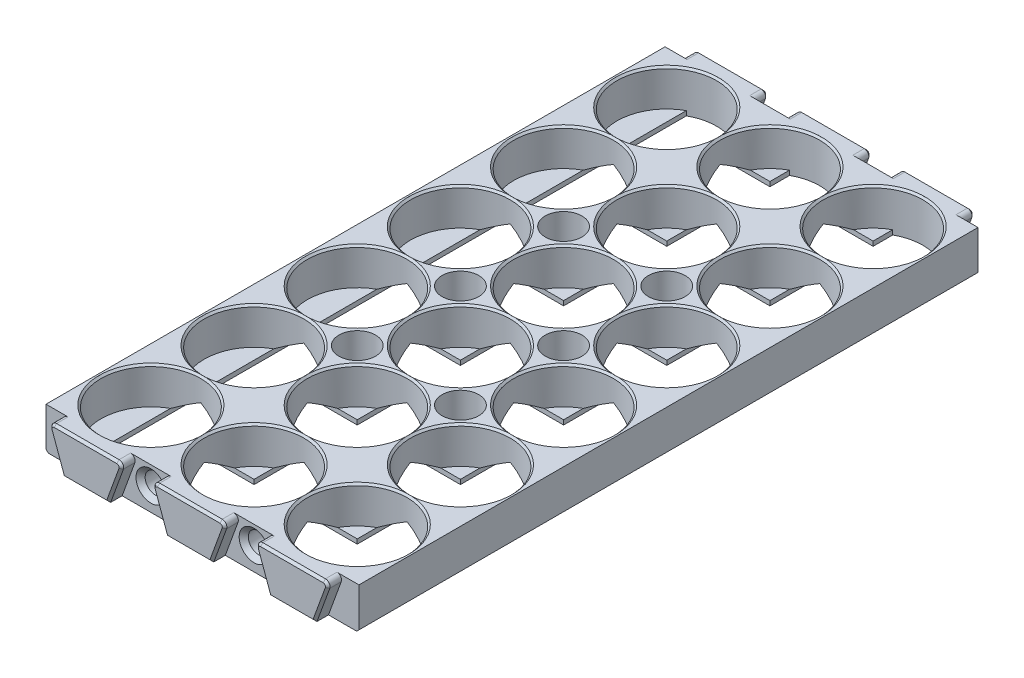
from build123d import *

# Parameters (mm, degrees)
SKETCH1_W                  = 22.5
SKETCH1_H                  = 22.5
SKETCH1_R                  = 10.875
BOSS_EXTRUDE1_DEPTH        = 8
SKETCH2_W                  = 6
SKETCH2_H                  = 6
BOSS_EXTRUDE2_DEPTH        = 1
CHAMFER2_SIZE              = 0.4
LPATTERN1_COUNT            = 6
LPATTERN1_PITCH            = 22.5
LPATTERN1_COUNT_DIR2       = 3
LPATTERN1_PITCH_DIR2       = 22.5
CHAMFER2_OF_LPATTERN1_SIZE = 0.4
SKETCH5_W                  = 6
SKETCH5_H                  = 1
BOSS_EXTRUDE3_DEPTH        = 123
BOSS_EXTRUDE4_START        = 1
BOSS_EXTRUDE4_DEPTH        = 1
CUT_EXTRUDE1_REACH         = 138.169
CUT_EXTRUDE7_REACH         = 138.169
BOSS_EXTRUDE5_DEPTH        = 3
BOSS_EXTRUDE6_DEPTH        = 3
FILLET1_R                  = 1
CHAMFER3_SIZE              = 0.5
SKETCH10_R                 = 2.25
CUT_EXTRUDE2_DEPTH         = 5
CUT_EXTRUDE3_START         = -5
SKETCH11_R                 = 2.25
CUT_EXTRUDE3_DEPTH         = 5
CHAMFER5_SIZE              = 1
SKETCH17_R                 = 4
CUT_EXTRUDE8_DEPTH         = 139.962674845
SKETCH18_R                 = 2.1
CUT_EXTRUDE9_DEPTH         = 4
SKETCH19_R                 = 1.7
CUT_EXTRUDE10_DEPTH        = 7
CHAMFER6_SIZE              = 1
SKETCH22_W                 = 0.375
SKETCH22_H                 = 135
BOSS_EXTRUDE7_DEPTH        = 9
CUT_EXTRUDE11_DEPTH        = 2
CHAMFER7_SIZE              = 0.5
CHAMFER9_SIZE              = 0.5


with BuildPart() as part:
    # Sketch1 → Boss-Extrude1 (new body)
    with BuildSketch(Plane(origin=(0, 0, 0), x_dir=(1, 0, 0), z_dir=(0, 1, 0))):
        Rectangle(SKETCH1_W, SKETCH1_H)
        with Locations(Location((0, 0, 0), (0, 0, 270))):
            Circle(SKETCH1_R, mode=Mode.SUBTRACT)
    boss_extrude1 = extrude(amount=BOSS_EXTRUDE1_DEPTH)

    # Sketch2 → Boss-Extrude2 (add)
    with BuildSketch(Plane.XZ):
        with Locations((8.25, 8.25)):
            Rectangle(SKETCH2_W, SKETCH2_H)
        with Locations((8.25, -8.25)):
            Rectangle(SKETCH2_W, SKETCH2_H)
        with Locations((-8.25, -8.25)):
            Rectangle(SKETCH2_W, SKETCH2_H)
        with Locations((-8.25, 8.25)):
            Rectangle(SKETCH2_W, SKETCH2_H)
    boss_extrude2 = extrude(amount=BOSS_EXTRUDE2_DEPTH)

    # Chamfer2
    # the kernel refuses this chamfer: 0.4 mm, written as the material it takes off along each edge
    with BuildSketch(Plane(origin=(0, 8, 0), x_dir=(0, 0, 1), z_dir=(-1, 0, 0))) as chamfer2_piece_1:
        Polygon((10.875, -CHAMFER2_SIZE), (10.875 + CHAMFER2_SIZE, 0), (10.875, 0), align=None)
    revolve(axis=Axis((0, 8, 0), (0, 1, 0)), mode=Mode.SUBTRACT)

    # LPattern1: Boss-Extrude1, Boss-Extrude2 6 × 3
    with Locations(*[(j * LPATTERN1_PITCH_DIR2, 0, i * LPATTERN1_PITCH) for i in range(LPATTERN1_COUNT) for j in range(LPATTERN1_COUNT_DIR2) if (i, j) != (0, 0)]):
        add(boss_extrude1)
        add(boss_extrude2)

    # Chamfer2 of LPattern1
    # the kernel refuses this chamfer: 0.4 mm, written as the material it takes off along each edge
    with BuildSketch(Plane(origin=(22.5, 8, 0), x_dir=(0, 0, 1), z_dir=(-1, 0, 0))) as chamfer2_of_lpattern1_piece_1:
        Polygon((10.875, -CHAMFER2_OF_LPATTERN1_SIZE), (10.875 + CHAMFER2_OF_LPATTERN1_SIZE, 0), (10.875, 0), align=None)
    revolve(axis=Axis((22.5, 8, 0), (0, 1, 0)), mode=Mode.SUBTRACT)
    with BuildSketch(Plane(origin=(45, 8, 0), x_dir=(0, 0, 1), z_dir=(-1, 0, 0))) as chamfer2_of_lpattern1_piece_2:
        Polygon((10.875 + CHAMFER2_OF_LPATTERN1_SIZE, 0), (10.875, -CHAMFER2_OF_LPATTERN1_SIZE), (10.875, 0), align=None)
    revolve(axis=Axis((45, 8, 0), (0, 1, 0)), mode=Mode.SUBTRACT)
    with BuildSketch(Plane(origin=(0, 8, 22.5), x_dir=(0, 0, 1), z_dir=(-1, 0, 0))) as chamfer2_of_lpattern1_piece_3:
        Polygon((10.875, -CHAMFER2_OF_LPATTERN1_SIZE), (10.875 + CHAMFER2_OF_LPATTERN1_SIZE, 0), (10.875, 0), align=None)
    revolve(axis=Axis((0, 8, 22.5), (0, 1, 0)), mode=Mode.SUBTRACT)
    with BuildSketch(Plane(origin=(22.5, 8, 22.5), x_dir=(0, 0, 1), z_dir=(-1, 0, 0))) as chamfer2_of_lpattern1_piece_4:
        Polygon((10.875, -CHAMFER2_OF_LPATTERN1_SIZE), (10.875 + CHAMFER2_OF_LPATTERN1_SIZE, 0), (10.875, 0), align=None)
    revolve(axis=Axis((22.5, 8, 22.5), (0, 1, 0)), mode=Mode.SUBTRACT)
    with BuildSketch(Plane(origin=(45, 8, 22.5), x_dir=(0, 0, 1), z_dir=(-1, 0, 0))) as chamfer2_of_lpattern1_piece_5:
        Polygon((10.875 + CHAMFER2_OF_LPATTERN1_SIZE, 0), (10.875, -CHAMFER2_OF_LPATTERN1_SIZE), (10.875, 0), align=None)
    revolve(axis=Axis((45, 8, 22.5), (0, 1, 0)), mode=Mode.SUBTRACT)
    with BuildSketch(Plane(origin=(0, 8, 45), x_dir=(0, 0, 1), z_dir=(-1, 0, 0))) as chamfer2_of_lpattern1_piece_6:
        Polygon((10.875, -CHAMFER2_OF_LPATTERN1_SIZE), (10.875 + CHAMFER2_OF_LPATTERN1_SIZE, 0), (10.875, 0), align=None)
    revolve(axis=Axis((0, 8, 45), (0, 1, 0)), mode=Mode.SUBTRACT)
    with BuildSketch(Plane(origin=(22.5, 8, 45), x_dir=(0, 0, 1), z_dir=(-1, 0, 0))) as chamfer2_of_lpattern1_piece_7:
        Polygon((10.875, -CHAMFER2_OF_LPATTERN1_SIZE), (10.875 + CHAMFER2_OF_LPATTERN1_SIZE, 0), (10.875, 0), align=None)
    revolve(axis=Axis((22.5, 8, 45), (0, 1, 0)), mode=Mode.SUBTRACT)
    with BuildSketch(Plane(origin=(45, 8, 45), x_dir=(0, 0, 1), z_dir=(-1, 0, 0))) as chamfer2_of_lpattern1_piece_8:
        Polygon((10.875, -CHAMFER2_OF_LPATTERN1_SIZE), (10.875 + CHAMFER2_OF_LPATTERN1_SIZE, 0), (10.875, 0), align=None)
    revolve(axis=Axis((45, 8, 45), (0, 1, 0)), mode=Mode.SUBTRACT)
    with BuildSketch(Plane(origin=(0, 8, 67.5), x_dir=(0, 0, 1), z_dir=(-1, 0, 0))) as chamfer2_of_lpattern1_piece_9:
        Polygon((10.875, -CHAMFER2_OF_LPATTERN1_SIZE), (10.875 + CHAMFER2_OF_LPATTERN1_SIZE, 0), (10.875, 0), align=None)
    revolve(axis=Axis((0, 8, 67.5), (0, 1, 0)), mode=Mode.SUBTRACT)
    with BuildSketch(Plane(origin=(22.5, 8, 67.5), x_dir=(0, 0, 1), z_dir=(-1, 0, 0))) as chamfer2_of_lpattern1_piece_10:
        Polygon((10.875, -CHAMFER2_OF_LPATTERN1_SIZE), (10.875 + CHAMFER2_OF_LPATTERN1_SIZE, 0), (10.875, 0), align=None)
    revolve(axis=Axis((22.5, 8, 67.5), (0, 1, 0)), mode=Mode.SUBTRACT)
    with BuildSketch(Plane(origin=(45, 8, 67.5), x_dir=(0, 0, 1), z_dir=(-1, 0, 0))) as chamfer2_of_lpattern1_piece_11:
        Polygon((10.875, -CHAMFER2_OF_LPATTERN1_SIZE), (10.875 + CHAMFER2_OF_LPATTERN1_SIZE, 0), (10.875, 0), align=None)
    revolve(axis=Axis((45, 8, 67.5), (0, 1, 0)), mode=Mode.SUBTRACT)
    with BuildSketch(Plane(origin=(0, 8, 90), x_dir=(0, 0, 1), z_dir=(-1, 0, 0))) as chamfer2_of_lpattern1_piece_12:
        Polygon((10.875, -CHAMFER2_OF_LPATTERN1_SIZE), (10.875 + CHAMFER2_OF_LPATTERN1_SIZE, 0), (10.875, 0), align=None)
    revolve(axis=Axis((0, 8, 90), (0, 1, 0)), mode=Mode.SUBTRACT)
    with BuildSketch(Plane(origin=(22.5, 8, 90), x_dir=(0, 0, 1), z_dir=(-1, 0, 0))) as chamfer2_of_lpattern1_piece_13:
        Polygon((10.875, -CHAMFER2_OF_LPATTERN1_SIZE), (10.875 + CHAMFER2_OF_LPATTERN1_SIZE, 0), (10.875, 0), align=None)
    revolve(axis=Axis((22.5, 8, 90), (0, 1, 0)), mode=Mode.SUBTRACT)
    with BuildSketch(Plane(origin=(45, 8, 90), x_dir=(0, 0, 1), z_dir=(-1, 0, 0))) as chamfer2_of_lpattern1_piece_14:
        Polygon((10.875, -CHAMFER2_OF_LPATTERN1_SIZE), (10.875 + CHAMFER2_OF_LPATTERN1_SIZE, 0), (10.875, 0), align=None)
    revolve(axis=Axis((45, 8, 90), (0, 1, 0)), mode=Mode.SUBTRACT)
    with BuildSketch(Plane(origin=(0, 8, 112.5), x_dir=(0, 0, 1), z_dir=(-1, 0, 0))) as chamfer2_of_lpattern1_piece_15:
        Polygon((10.875, -CHAMFER2_OF_LPATTERN1_SIZE), (10.875 + CHAMFER2_OF_LPATTERN1_SIZE, 0), (10.875, 0), align=None)
    revolve(axis=Axis((0, 8, 112.5), (0, 1, 0)), mode=Mode.SUBTRACT)
    with BuildSketch(Plane(origin=(22.5, 8, 112.5), x_dir=(0, 0, 1), z_dir=(-1, 0, 0))) as chamfer2_of_lpattern1_piece_16:
        Polygon((10.875, -CHAMFER2_OF_LPATTERN1_SIZE), (10.875 + CHAMFER2_OF_LPATTERN1_SIZE, 0), (10.875, 0), align=None)
    revolve(axis=Axis((22.5, 8, 112.5), (0, 1, 0)), mode=Mode.SUBTRACT)
    with BuildSketch(Plane(origin=(45, 8, 112.5), x_dir=(0, 0, 1), z_dir=(-1, 0, 0))) as chamfer2_of_lpattern1_piece_17:
        Polygon((10.875, -CHAMFER2_OF_LPATTERN1_SIZE), (10.875 + CHAMFER2_OF_LPATTERN1_SIZE, 0), (10.875, 0), align=None)
    revolve(axis=Axis((45, 8, 112.5), (0, 1, 0)), mode=Mode.SUBTRACT)

    # Sketch5 → Boss-Extrude3 (add)
    with BuildSketch(Plane.XY.offset(-5.25)):
        with Locations((-8.25, -0.5)):
            Rectangle(SKETCH5_W, SKETCH5_H)
        with Locations((53.25, -0.5)):
            Rectangle(SKETCH5_W, SKETCH5_H)
    extrude(amount=BOSS_EXTRUDE3_DEPTH)

    # Sketch6 → Boss-Extrude4 (add)
    with BuildSketch(Plane.XZ.offset(BOSS_EXTRUDE4_START)):
        with BuildLine():
            Line((39.75, -11.25), (50.25, -11.25))
            Line((50.25, -11.25), (50.25, -9.523818824))
            ThreePointArc((50.25, -9.523818824), (45, -10.875), (39.75, -9.523818824))
            Line((39.75, -9.523818824), (39.75, -11.25))
        make_face()
        with BuildLine():
            Line((17.25, -9.523818824), (17.25, -11.25))
            Line((17.25, -11.25), (27.75, -11.25))
            Line((27.75, -11.25), (27.75, -9.523818824))
            ThreePointArc((27.75, -9.523818824), (22.5, -10.875), (17.25, -9.523818824))
        make_face()
        with BuildLine():
            Line((-5.25, -9.523818824), (-5.25, -11.25))
            Line((-5.25, -11.25), (5.25, -11.25))
            Line((5.25, -11.25), (5.25, -9.523818824))
            ThreePointArc((5.25, -9.523818824), (0, -10.875), (-5.25, -9.523818824))
        make_face()
        with BuildLine():
            Line((50.25, 122.023818824), (50.25, 123.75))
            Line((50.25, 123.75), (39.75, 123.75))
            Line((39.75, 123.75), (39.75, 122.023818824))
            ThreePointArc((39.75, 122.023818824), (45, 123.375), (50.25, 122.023818824))
        make_face()
        with BuildLine():
            Line((27.75, 122.023818824), (27.75, 123.75))
            Line((27.75, 123.75), (17.25, 123.75))
            Line((17.25, 123.75), (17.25, 122.023818824))
            ThreePointArc((17.25, 122.023818824), (22.5, 123.375), (27.75, 122.023818824))
        make_face()
        with BuildLine():
            Line((5.25, 123.75), (-5.25, 123.75))
            Line((-5.25, 123.75), (-5.25, 122.023818824))
            ThreePointArc((-5.25, 122.023818824), (0, 123.375), (5.25, 122.023818824))
            Line((5.25, 122.023818824), (5.25, 123.75))
        make_face()
    extrude(amount=-BOSS_EXTRUDE4_DEPTH)

    # Cut-Extrude1: up to this face of the body (flat: up to its plane)
    cut_extrude1_end = Plane(part.part.faces().sort_by_distance((11.25, -0.5, 117.75))[0])
    # Sketch7 → Cut-Extrude1 (cut, up to the picked face)
    with BuildSketch(Plane.XY, mode=Mode.PRIVATE) as cut_extrude1_sk1:
        Polygon((-5.25, 0), (5.25, 0), (0, 3.031088913), align=None)
    cut_extrude1_tool1 = split(extrude(cut_extrude1_sk1.sketch, amount=CUT_EXTRUDE1_REACH, mode=Mode.PRIVATE), bisect_by=cut_extrude1_end, keep=Keep.BOTH, mode=Mode.PRIVATE)
    # Sketch7 → Cut-Extrude1 (cut, up to the picked face)
    with BuildSketch(Plane.XY, mode=Mode.PRIVATE) as cut_extrude1_sk2:
        Polygon((17.25, 0), (22.5, 3.031088913), (27.75, 0), align=None)
    cut_extrude1_tool2 = split(extrude(cut_extrude1_sk2.sketch, amount=CUT_EXTRUDE1_REACH, mode=Mode.PRIVATE), bisect_by=cut_extrude1_end, keep=Keep.BOTH, mode=Mode.PRIVATE)
    # Sketch7 → Cut-Extrude1 (cut, up to the picked face)
    with BuildSketch(Plane.XY, mode=Mode.PRIVATE) as cut_extrude1_sk3:
        Polygon((39.75, 0), (45, 3.031088913), (50.25, 0), align=None)
    cut_extrude1_tool3 = split(extrude(cut_extrude1_sk3.sketch, amount=CUT_EXTRUDE1_REACH, mode=Mode.PRIVATE), bisect_by=cut_extrude1_end, keep=Keep.BOTH, mode=Mode.PRIVATE)
    add(cut_extrude1_tool1.solids().sort_by(Axis((0, 1.010363, 0), (0, 0, 1)))[0], mode=Mode.SUBTRACT)
    add(cut_extrude1_tool2.solids().sort_by(Axis((22.5, 1.010363, 0), (0, 0, 1)))[0], mode=Mode.SUBTRACT)
    add(cut_extrude1_tool3.solids().sort_by(Axis((45, 1.010363, 0), (0, 0, 1)))[0], mode=Mode.SUBTRACT)

    # Cut-Extrude7: up to this face of the body (flat: up to its plane)
    cut_extrude7_end = Plane(part.part.faces().sort_by_distance((39.75, -0.5, 11.25))[0])
    # Sketch16 → Cut-Extrude7 (cut, up to the picked face)
    with BuildSketch(Plane(origin=(0, 0, 0), x_dir=(0, 0, -1), z_dir=(1, 0, 0)), mode=Mode.PRIVATE) as cut_extrude7_sk1:
        Polygon((-5.25, 0), (0, 3.031088913), (5.25, 0), align=None)
    cut_extrude7_tool1 = split(extrude(cut_extrude7_sk1.sketch, amount=CUT_EXTRUDE7_REACH, mode=Mode.PRIVATE), bisect_by=cut_extrude7_end, keep=Keep.BOTH, mode=Mode.PRIVATE)
    # Sketch16 → Cut-Extrude7 (cut, up to the picked face)
    with BuildSketch(Plane(origin=(0, 0, 0), x_dir=(0, 0, -1), z_dir=(1, 0, 0)), mode=Mode.PRIVATE) as cut_extrude7_sk2:
        Polygon((-22.5, 3.031088913), (-17.25, 0), (-27.75, 0), align=None)
    cut_extrude7_tool2 = split(extrude(cut_extrude7_sk2.sketch, amount=CUT_EXTRUDE7_REACH, mode=Mode.PRIVATE), bisect_by=cut_extrude7_end, keep=Keep.BOTH, mode=Mode.PRIVATE)
    # Sketch16 → Cut-Extrude7 (cut, up to the picked face)
    with BuildSketch(Plane(origin=(0, 0, 0), x_dir=(0, 0, -1), z_dir=(1, 0, 0)), mode=Mode.PRIVATE) as cut_extrude7_sk3:
        Polygon((-45, 3.031088913), (-39.75, 0), (-50.25, 0), align=None)
    cut_extrude7_tool3 = split(extrude(cut_extrude7_sk3.sketch, amount=CUT_EXTRUDE7_REACH, mode=Mode.PRIVATE), bisect_by=cut_extrude7_end, keep=Keep.BOTH, mode=Mode.PRIVATE)
    # Sketch16 → Cut-Extrude7 (cut, up to the picked face)
    with BuildSketch(Plane(origin=(0, 0, 0), x_dir=(0, 0, -1), z_dir=(1, 0, 0)), mode=Mode.PRIVATE) as cut_extrude7_sk4:
        Polygon((-67.5, 3.031088913), (-62.25, 0), (-72.75, 0), align=None)
    cut_extrude7_tool4 = split(extrude(cut_extrude7_sk4.sketch, amount=CUT_EXTRUDE7_REACH, mode=Mode.PRIVATE), bisect_by=cut_extrude7_end, keep=Keep.BOTH, mode=Mode.PRIVATE)
    # Sketch16 → Cut-Extrude7 (cut, up to the picked face)
    with BuildSketch(Plane(origin=(0, 0, 0), x_dir=(0, 0, -1), z_dir=(1, 0, 0)), mode=Mode.PRIVATE) as cut_extrude7_sk5:
        Polygon((-90, 3.031088913), (-84.75, 0), (-95.25, 0), align=None)
    cut_extrude7_tool5 = split(extrude(cut_extrude7_sk5.sketch, amount=CUT_EXTRUDE7_REACH, mode=Mode.PRIVATE), bisect_by=cut_extrude7_end, keep=Keep.BOTH, mode=Mode.PRIVATE)
    # Sketch16 → Cut-Extrude7 (cut, up to the picked face)
    with BuildSketch(Plane(origin=(0, 0, 0), x_dir=(0, 0, -1), z_dir=(1, 0, 0)), mode=Mode.PRIVATE) as cut_extrude7_sk6:
        Polygon((-112.5, 3.031088913), (-107.25, 0), (-117.75, 0), align=None)
    cut_extrude7_tool6 = split(extrude(cut_extrude7_sk6.sketch, amount=CUT_EXTRUDE7_REACH, mode=Mode.PRIVATE), bisect_by=cut_extrude7_end, keep=Keep.BOTH, mode=Mode.PRIVATE)
    add(cut_extrude7_tool1.solids().sort_by(Axis((0, 1.010363, 0), (1, 0, 0)))[0], mode=Mode.SUBTRACT)
    add(cut_extrude7_tool2.solids().sort_by(Axis((0, 1.010363, 22.5), (1, 0, 0)))[0], mode=Mode.SUBTRACT)
    add(cut_extrude7_tool3.solids().sort_by(Axis((0, 1.010363, 45), (1, 0, 0)))[0], mode=Mode.SUBTRACT)
    add(cut_extrude7_tool4.solids().sort_by(Axis((0, 1.010363, 67.5), (1, 0, 0)))[0], mode=Mode.SUBTRACT)
    add(cut_extrude7_tool5.solids().sort_by(Axis((0, 1.010363, 90), (1, 0, 0)))[0], mode=Mode.SUBTRACT)
    add(cut_extrude7_tool6.solids().sort_by(Axis((0, 1.010363, 112.5), (1, 0, 0)))[0], mode=Mode.SUBTRACT)

    # Sketch8 → Boss-Extrude5 (add)
    with BuildSketch(Plane(origin=(0, 0, -11.25), x_dir=(-1, 0, 0), z_dir=(0, 0, -1))):
        Polygon((-27.474267892, -1), (-30.75, 8), (-14.25, 8), (-17.525732108, -1), align=None)
        Polygon((4.974267892, -1), (-4.974267892, -1), (-8.25, 8), (8.25, 8), align=None)
        Polygon((-49.974267892, -1), (-53.25, 8), (-36.75, 8), (-40.025732108, -1), align=None)
    extrude(amount=BOSS_EXTRUDE5_DEPTH)

    # Sketch9 → Boss-Extrude6 (add)
    with BuildSketch(Plane.XY.offset(123.75)):
        Polygon((-4.974267892, -1), (4.974267892, -1), (8.25, 8), (-8.25, 8), align=None)
        Polygon((49.974267892, -1), (53.25, 8), (36.75, 8), (40.025732108, -1), align=None)
        Polygon((14.25, 8), (17.525732108, -1), (27.474267892, -1), (30.75, 8), align=None)
    extrude(amount=BOSS_EXTRUDE6_DEPTH)

    # Fillet1
    fillet1_edges = [part.edges().sort_by_distance(p)[0] for p in [
        (-8.25, 8, -12.75),
        (8.25, 8, -12.75),
        (14.25, 8, -12.75),
        (30.75, 8, -12.75),
        (36.75, 8, -12.75),
        (53.25, 8, -12.75),
        (-8.25, 8, 125.25),
        (8.25, 8, 125.25),
        (53.25, 8, 125.25),
        (36.75, 8, 125.25),
        (30.75, 8, 125.25),
        (14.25, 8, 125.25),
    ]]
    fillet(fillet1_edges, radius=FILLET1_R)

    # Chamfer3
    chamfer3_edges = [part.edges().sort_by_distance(p)[0] for p in [
        (0, -1, -14.25),
        (-6.367906253, 2.828989928, -14.25),
        (22.5, -1, -14.25),
        (16.132093747, 2.828989928, -14.25),
        (45, -1, -14.25),
        (38.632093747, 2.828989928, -14.25),
        (0, -1, 126.75),
        (6.367906253, 2.828989928, 126.75),
        (45, -1, 126.75),
        (51.367906253, 2.828989928, 126.75),
        (22.5, -1, 126.75),
        (28.867906253, 2.828989928, 126.75),
        (0, 8, 126.75),
        (22.5, 8, 126.75),
        (45, 8, 126.75),
        (-6.367906253, 2.828989928, 126.75),
        (-7.641004038, 7.573576436, 126.75),
        (7.641004038, 7.573576436, 126.75),
        (16.132093747, 2.828989928, 126.75),
        (30.141004038, 7.573576436, 126.75),
        (14.858995962, 7.573576436, 126.75),
        (38.632093747, 2.828989928, 126.75),
        (52.641004038, 7.573576436, 126.75),
        (37.358995962, 7.573576436, 126.75),
        (51.367906253, 2.828989928, -14.25),
        (45, 8, -14.25),
        (22.5, 8, -14.25),
        (0, 8, -14.25),
        (37.358995962, 7.573576436, -14.25),
        (52.641004038, 7.573576436, -14.25),
        (28.867906253, 2.828989928, -14.25),
        (14.858995962, 7.573576436, -14.25),
        (30.141004038, 7.573576436, -14.25),
        (6.367906253, 2.828989928, -14.25),
        (-7.641004038, 7.573576436, -14.25),
        (7.641004038, 7.573576436, -14.25),
    ]]
    chamfer(chamfer3_edges, length=CHAMFER3_SIZE)

    # Sketch10 → Cut-Extrude2 (cut)
    with BuildSketch(Plane(origin=(0, 0, -11.25), x_dir=(-1, 0, 0), z_dir=(0, 0, -1))):
        with Locations((-11.25, 4)):
            Circle(SKETCH10_R)
        with Locations(Location((-33.75, 4, 0), (0, 0, 180))):
            Circle(SKETCH10_R)
    extrude(amount=-CUT_EXTRUDE2_DEPTH, mode=Mode.SUBTRACT)

    # Sketch11 → Cut-Extrude3 (cut)
    with BuildSketch(Plane.XY.offset(123.75).offset(CUT_EXTRUDE3_START)):
        with Locations(Location((11.25, 4, 0), (0, 0, 180))):
            Circle(SKETCH11_R)
        with Locations((33.75, 4)):
            Circle(SKETCH11_R)
    extrude(amount=CUT_EXTRUDE3_DEPTH, mode=Mode.SUBTRACT)

    # Chamfer5
    chamfer5_edges = [part.edges().sort_by_distance(p)[0] for p in [
        (31.5, 4, -11.25),
        (13.5, 4, -11.25),
        (13.5, 4, 123.75),
        (31.5, 4, 123.75),
    ]]
    chamfer(chamfer5_edges, length=CHAMFER5_SIZE)

    # Sketch17 → Cut-Extrude8 (cut, through all)
    with BuildSketch(Plane.XZ.offset(1)):
        with Locations(Location((33.75, 33.75, 0), (0, 0, 270))):
            Circle(SKETCH17_R)
        with Locations(Location((33.75, 56.25, 0), (0, 0, 270))):
            Circle(SKETCH17_R)
        with Locations(Location((33.75, 78.75, 0), (0, 0, 270))):
            Circle(SKETCH17_R)
        with Locations(Location((11.25, 33.75, 0), (0, 0, 270))):
            Circle(SKETCH17_R)
        with Locations(Location((11.25, 56.25, 0), (0, 0, 270))):
            Circle(SKETCH17_R)
        with Locations(Location((11.25, 78.75, 0), (0, 0, 270))):
            Circle(SKETCH17_R)
    extrude(amount=-CUT_EXTRUDE8_DEPTH, mode=Mode.SUBTRACT)

    # Sketch18 → Cut-Extrude9 (cut)
    with BuildSketch(Plane.XZ.offset(1)):
        with Locations(Location((11.25, 11.25, 0), (0, 0, 270))):
            Circle(SKETCH18_R)
        with Locations(Location((33.75, 11.25, 0), (0, 0, 270))):
            Circle(SKETCH18_R)
        with Locations(Location((33.75, 101.25, 0), (0, 0, 90))):
            Circle(SKETCH18_R)
        with Locations(Location((11.25, 101.25, 0), (0, 0, 90))):
            Circle(SKETCH18_R)
    extrude(amount=-CUT_EXTRUDE9_DEPTH, mode=Mode.SUBTRACT)

    # Sketch19 → Cut-Extrude10 (cut)
    with BuildSketch(Plane.XZ.offset(1)):
        with Locations(Location((33.75, 11.25, 0), (0, 0, 270))):
            Circle(SKETCH19_R)
        with Locations(Location((11.25, 11.25, 0), (0, 0, 270))):
            Circle(SKETCH19_R)
        with Locations(Location((11.25, 101.25, 0), (0, 0, 270))):
            Circle(SKETCH19_R)
        with Locations(Location((33.75, 101.25, 0), (0, 0, 270))):
            Circle(SKETCH19_R)
    extrude(amount=-CUT_EXTRUDE10_DEPTH, mode=Mode.SUBTRACT)

    # Chamfer6
    chamfer6_edges = [part.edges().sort_by_distance(p)[0] for p in [
        (11.25, -1, 99.15),
        (33.75, -1, 99.15),
        (33.75, -1, 13.35),
        (11.25, -1, 13.35),
    ]]
    chamfer(chamfer6_edges, length=CHAMFER6_SIZE)

    # Sketch22 → Boss-Extrude7 (add)
    with BuildSketch(Plane(origin=(0, 8, 0), x_dir=(1, 0, 0), z_dir=(0, 1, 0))):
        with Locations((-11.4375, -56.25)):
            Rectangle(SKETCH22_W, SKETCH22_H)
        with Locations((56.4375, -56.25)):
            Rectangle(SKETCH22_W, SKETCH22_H)
    extrude(amount=-BOSS_EXTRUDE7_DEPTH)

    # Sketch14 → Cut-Extrude11 (cut)
    with BuildSketch(Plane.XZ.offset(1)):
        Polygon((-10.25, 53.794119063), (-10.25, 58.705880937), (-6.25, 57.25), (-6.25, 55.25), align=None)
        Polygon((-10.25, 13.705880937), (-6.25, 12.25), (-6.25, 10.25), (-10.25, 8.794119063), align=None)
        Polygon((55.25, 53.794119063), (51.25, 55.25), (51.25, 57.25), (55.25, 58.705880937), align=None)
        Polygon((55.25, 8.794119063), (51.25, 10.25), (51.25, 12.25), (55.25, 13.705880937), align=None)
        Polygon((-10.25, 103.705880937), (-6.25, 102.25), (-6.25, 100.25), (-10.25, 98.794119063), align=None)
        Polygon((55.25, 98.794119063), (51.25, 100.25), (51.25, 102.25), (55.25, 103.705880937), align=None)
    extrude(amount=-CUT_EXTRUDE11_DEPTH, mode=Mode.SUBTRACT)

    # Chamfer7
    chamfer7_edges = [part.edges().sort_by_distance(p)[0] for p in [
        (-8.25, -1, 57.977940469),
        (-10.25, -1, 56.25),
        (-8.25, -1, 54.522059531),
        (-6.25, -1, 56.25),
        (55.25, -1, 101.25),
        (53.25, -1, 102.977940469),
        (51.25, -1, 101.25),
        (53.25, -1, 99.522059531),
        (55.25, -1, 11.25),
        (53.25, -1, 12.977940469),
        (51.25, -1, 11.25),
        (53.25, -1, 9.522059531),
        (55.25, -1, 56.25),
        (53.25, -1, 57.977940469),
        (51.25, -1, 56.25),
        (53.25, -1, 54.522059531),
        (-10.25, -1, 101.25),
        (-8.25, -1, 99.522059531),
        (-6.25, -1, 101.25),
        (-8.25, -1, 102.977940469),
        (-6.25, -1, 11.25),
        (-8.25, -1, 12.977940469),
        (-10.25, -1, 11.25),
        (-8.25, -1, 9.522059531),
    ]]
    chamfer(chamfer7_edges, length=CHAMFER7_SIZE)

    # Chamfer9
    chamfer9_edges = [part.edges().sort_by_distance(p)[0] for p in [
        (-11.625, -1, 56.25),
        (56.625, -1, 56.25),
    ]]
    chamfer(chamfer9_edges, length=CHAMFER9_SIZE)


solid = part.part
